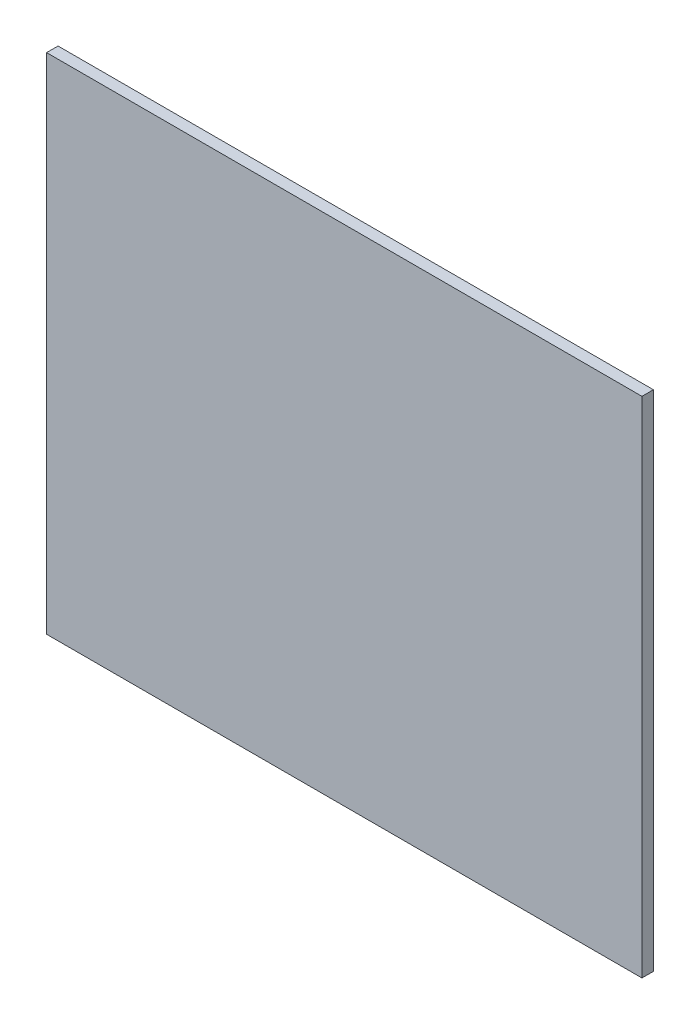
from build123d import *

# Parameters (mm, degrees)
SKETCH1_W           = 330.2
SKETCH1_H           = 279.4
BOSS_EXTRUDE1_DEPTH = 3.175


with BuildPart() as part:
    # Sketch1 → Boss-Extrude1 (new, symmetric)
    with BuildSketch(Plane.XY):
        Rectangle(SKETCH1_W, SKETCH1_H)
    extrude(amount=BOSS_EXTRUDE1_DEPTH, both=True)


solid = part.part
